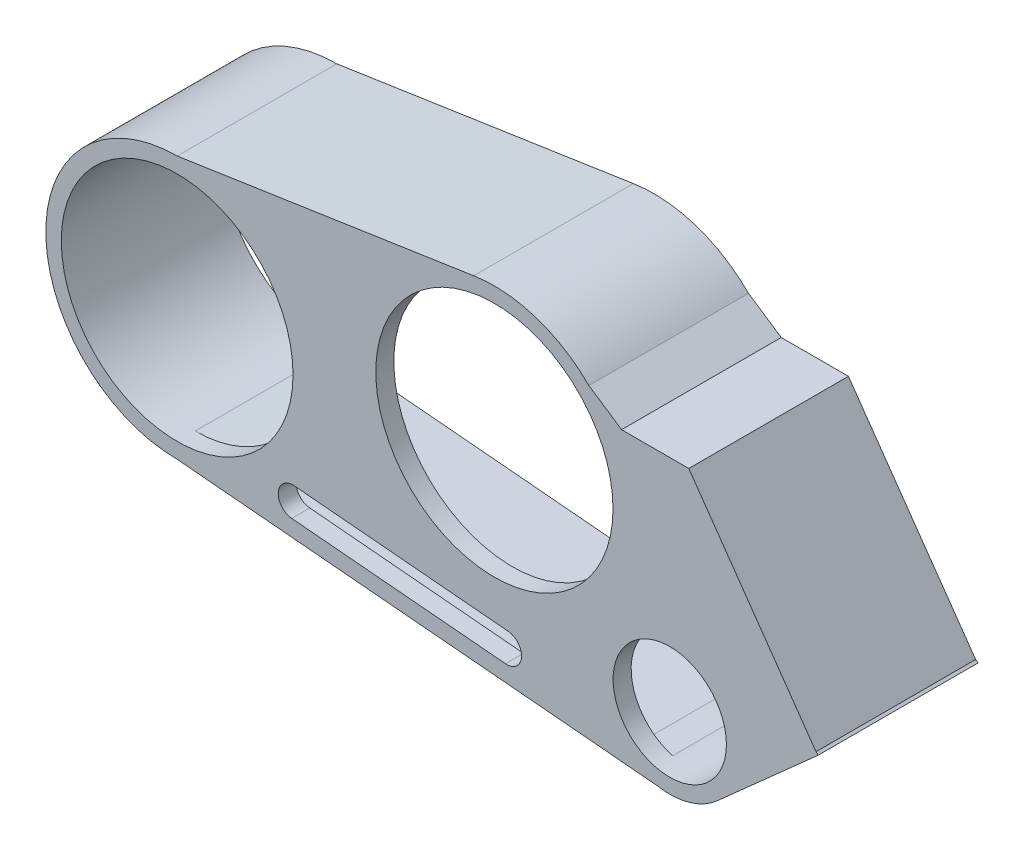
from build123d import *

# Parameters (mm, degrees)
SKETCH1_W           = 300
SKETCH1_H           = 152
BOSS_EXTRUDE1_DEPTH = 62
CUT_EXTRUDE2_DEPTH  = 342.976607387
SKETCH7_R           = 45
SKETCH7_R_2         = 46.06
SKETCH7_R_3         = 22
CUT_EXTRUDE4_DEPTH  = 339.496676498
CUT_EXTRUDE6_DEPTH  = 339.496676498
CUT_EXTRUDE9_DEPTH  = 339.496676498
SHELL2_DEPTH        = 57
CUT_EXTRUDE10_DEPTH = 55


# Read off the part's stored shape, not the designer's step: Shell2
with BuildPart() as part:
    # Sketch1 → Boss-Extrude1 (new body)
    with BuildSketch(Plane.XY):
        with Locations((150, -76)):
            Rectangle(SKETCH1_W, SKETCH1_H)
    extrude(amount=BOSS_EXTRUDE1_DEPTH)

    # Sketch2 → Cut-Extrude2 (cut, through all)
    with BuildSketch(Plane.XY.offset(62)):
        with BuildLine():
            ThreePointArc((51, -127), (14.937554126, -112.062445807), (0, -75.999999905))
            Line((0, -75.999999905), (0, -152))
            Line((0, -152), (300, -152))
            Line((300, -152), (300, -102))
            Line((300, -102), (260.724181003, -136.984282786))
            ThreePointArc((260.724181003, -136.984282786), (252.157366961, -142.186720854), (242.3, -144))
            ThreePointArc((242.3, -144), (239.848083808, -143.891268673), (237.415416722, -143.565928303))
            Line((237.415416722, -143.565928303), (51, -127))
        make_face()
        with BuildLine():
            ThreePointArc((0, -75.999999905), (14.937554193, -39.937554126), (51, -25))
            Line((51, -25), (166.163471247, -7.695622939))
            ThreePointArc((166.163471247, -7.695622939), (190.26153232, -9.61627718), (210.878909402, -22.238845161))
            Line((210.878909402, -22.238845161), (251.946068796, -20.152501272))
            Line((251.946068796, -20.152501272), (300, -102))
            Line((300, -102), (300, 0))
            Line((300, 0), (0, 0))
            Line((0, 0), (0, -75.999999905))
        make_face()
    extrude(amount=-CUT_EXTRUDE2_DEPTH, mode=Mode.SUBTRACT)

    # Sketch7 → Cut-Extrude4 (cut, through all)
    with BuildSketch(Plane.XY.offset(62)):
        with Locations((51, -76)):
            Circle(SKETCH7_R)
        with Locations((174.2, -59)):
            Circle(SKETCH7_R_2)
        with Locations((242.3, -116.3)):
            Circle(SKETCH7_R_3)
    extrude(amount=-CUT_EXTRUDE4_DEPTH, mode=Mode.SUBTRACT)

    # Sketch6 → Cut-Extrude6 (cut, through all)
    with BuildSketch(Plane.XY.offset(62)):
        with BuildLine():
            Line((95.491028227, -124.62889745), (178.491028227, -132.004746901))
            ThreePointArc((178.491028227, -132.004746901), (184.727429418, -126.786289256), (179.508971773, -120.549888066))
            Line((179.508971773, -120.549888066), (96.508971773, -113.174038615))
            ThreePointArc((96.508971773, -113.174038615), (90.272570582, -118.39249626), (95.491028227, -124.62889745))
        make_face()
    extrude(amount=-CUT_EXTRUDE6_DEPTH, mode=Mode.SUBTRACT)

    # Sketch10 → Cut-Extrude9 (cut, through all)
    with BuildSketch(Plane.XY.offset(62)):
        Polygon((210.878909402, -22.238845161), (223.578909402, -30.744161401), (249.678909402, -30.744161401), (299.082639453, -101.3), (300, -102), (251.946068796, -20.152501272), align=None)
    extrude(amount=-CUT_EXTRUDE9_DEPTH, mode=Mode.SUBTRACT)

    # Shell2 outline → Shell2 (cut)
    with BuildSketch(Plane.XY):
        with BuildLine():
            ThreePointArc((179.951555923, -115.569514659), (189.137709243, -122.70109723), (186.459518175, -134.017995012))
            Line((186.459518175, -134.017995012), (225.572036413, -137.493754604))
            ThreePointArc((225.572036413, -137.493754604), (233.913861687, -90.635380692), (268.314757677, -123.52719745))
            Line((268.314757677, -123.52719745), (293.090088132, -101.458983754))
            Line((293.090088132, -101.458983754), (247.076074149, -35.744161401))
            Line((247.076074149, -35.744161401), (222.05928739, -35.744161401))
            Line((222.05928739, -35.744161401), (218.263483983, -33.202074129))
            ThreePointArc((218.263483983, -33.202074129), (161.890244674, -108.553945593), (147.330636825, -15.581560109))
            Line((147.330636825, -15.581560109), (64.89221906, -27.968695108))
            ThreePointArc((64.89221906, -27.968695108), (100.988642148, -74.934328279), (66.926556679, -123.39561997))
            Line((66.926556679, -123.39561997), (87.292394522, -125.205443511))
            ThreePointArc((87.292394522, -125.205443511), (86.651779504, -113.593617849), (96.951555923, -108.193665208))
            Line((96.951555923, -108.193665208), (179.951555923, -115.569514659))
        make_face()
    extrude(amount=SHELL2_DEPTH, mode=Mode.SUBTRACT)

    # Sketch12 → Cut-Extrude10 (cut)
    with BuildSketch(Plane(origin=(0, 0, 0), x_dir=(-1, 0, 0), z_dir=(0, 0, -1))):
        with BuildLine():
            Line((-64.89221906, -27.968695108), (-51, -31))
            ThreePointArc((-51, -31), (-96, -76), (-51, -121))
            Line((-51, -121), (-66.926556679, -123.39561997))
            ThreePointArc((-66.926556679, -123.39561997), (-100.988642148, -74.934328279), (-64.89221906, -27.968695108))
        make_face()
        with BuildLine():
            Line((-268.314757677, -123.52719745), (-259.127186744, -130.472007137))
            ThreePointArc((-259.127186744, -130.472007137), (-235.806137419, -95.280253361), (-236.398748795, -137.493754604))
            Line((-236.398748795, -137.493754604), (-225.572036413, -137.493754604))
            ThreePointArc((-225.572036413, -137.493754604), (-233.913861687, -90.635380692), (-268.314757677, -123.52719745))
        make_face()
        with BuildLine():
            Line((-186.459518175, -134.017995012), (-87.292394522, -125.205443511))
            ThreePointArc((-87.292394522, -125.205443511), (-86.651779504, -113.593617849), (-96.951555923, -108.193665208))
            Line((-96.951555923, -108.193665208), (-179.951555923, -115.569514659))
            ThreePointArc((-179.951555923, -115.569514659), (-189.137709243, -122.70109723), (-186.459518175, -134.017995012))
        make_face()
        with BuildLine():
            Line((-218.263483983, -33.202074129), (-200.666763454, -21.30339495))
            ThreePointArc((-200.666763454, -21.30339495), (-163.274286328, -103.745417428), (-168.084950709, -13.347729825))
            Line((-168.084950709, -13.347729825), (-147.330636825, -15.581560109))
            ThreePointArc((-147.330636825, -15.581560109), (-161.890244675, -108.553945593), (-218.263483983, -33.202074129))
        make_face()
    extrude(amount=-CUT_EXTRUDE10_DEPTH, mode=Mode.SUBTRACT)


solid = part.part
